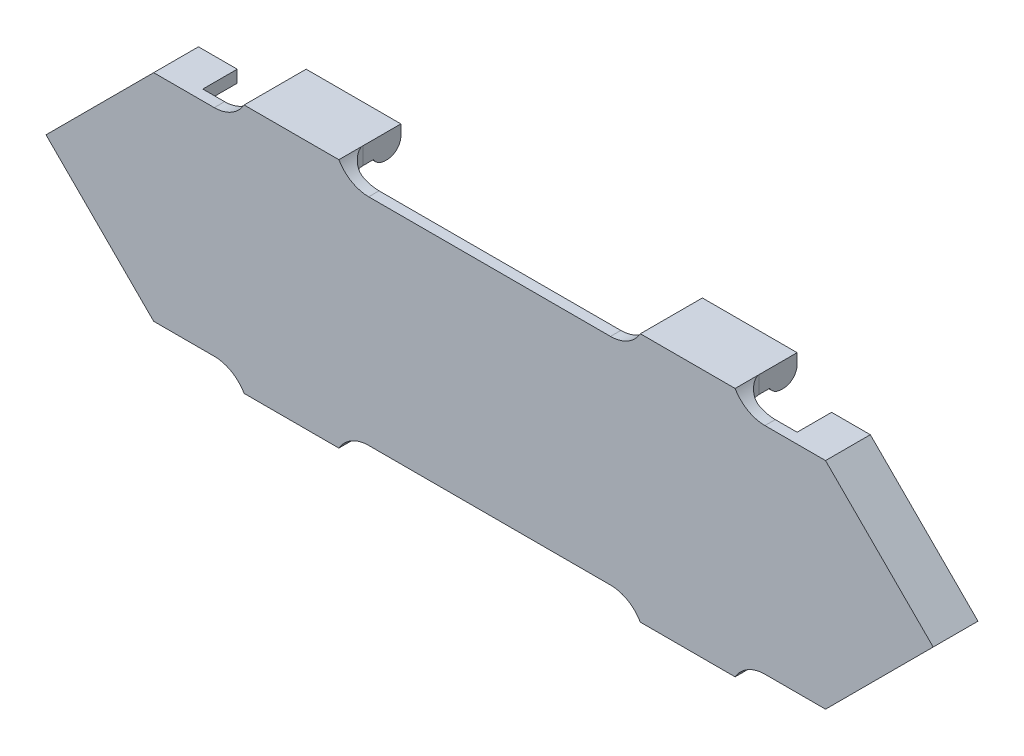
from build123d import *

# Parameters (mm, degrees)
BOSS_EXTRUDE1_DEPTH  = 0.762
BOSS_EXTRUDE2_DEPTH  = 2.54
SKETCH4_W            = 6.985
SKETCH4_H            = 4.572
BOSS_EXTRUDE3_DEPTH  = 1.27
FILLET1_R            = 2.54
SKETCH5_W            = 6.985
SKETCH5_H            = 2.032
BOSS_EXTRUDE4_DEPTH  = 0.508
FILLET2_R            = 1.016
FILLET3_R            = 1.016
FILLET2_OF_MIRROR4_R = 1.016
FILLET4_R            = 2.54
FILLET5_R            = 1.016


with BuildPart() as part:
    # Sketch1 → Boss-Extrude1 (new body)
    with BuildSketch(Plane.XY):
        Polygon((-33.378913043, 6.316869565), (16.151086957, 6.316869565), (24.088586957, -1.620630435), (16.151086957, -9.558130435), (-33.378913043, -9.558130435), (-41.316413043, -1.620630435), align=None)
    extrude(amount=BOSS_EXTRUDE1_DEPTH)

    # Sketch2 → Boss-Extrude2 (add)
    with BuildSketch(Plane(origin=(0, 0, 0), x_dir=(-1, 0, 0), z_dir=(0, 0, -1))):
        Polygon((30.521413043, 6.316869565), (33.378913043, 6.316869565), (41.316413043, -1.620630435), (33.378913043, -9.558130435), (30.521413043, -9.558130435), (30.521413043, -8.660104823), (32.480887431, -8.660104823), (39.520361819, -1.620630435), (32.480887431, 5.418843953), (30.521413043, 5.418843953), align=None)
        Polygon((-16.151086957, -9.558130435), (-24.088586957, -1.620630435), (-16.151086957, 6.316869565), (-13.293586957, 6.316869565), (-13.293586957, 5.418843953), (-15.253061344, 5.418843953), (-22.292535732, -1.620630435), (-15.253061344, -8.660104823), (-13.293586957, -8.660104823), (-13.293586957, -9.558130435), align=None)
    extrude(amount=BOSS_EXTRUDE2_DEPTH)

    # Sketch4 → Boss-Extrude3 (add)
    with BuildSketch(Plane(origin=(0, 6.316869565, 0), x_dir=(1, 0, 0), z_dir=(0, 1, 0))):
        with Locations((5.991086957, 1.524)):
            Rectangle(SKETCH4_W, SKETCH4_H)
        with Locations((-23.218913043, 1.524)):
            Rectangle(SKETCH4_W, SKETCH4_H)
    boss_extrude3 = extrude(amount=BOSS_EXTRUDE3_DEPTH)

    # Fillet1
    # the kernel refuses this fillet: 2.54 mm, written as the material it adds along each edge
    with BuildSketch(Plane(origin=(-26.711413043, 6.316869565, 0.762), x_dir=(-1, 0, 0), z_dir=(0, 0, -1)), Plane(origin=(-19.726413043, 6.316869565, 0), x_dir=(1, 0, 0), z_dir=(0, 0, 1)), Plane(origin=(2.498586957, 6.316869565, 0.762), x_dir=(-1, 0, 0), z_dir=(0, 0, -1)), Plane(origin=(9.483586957, 6.316869565, 0), x_dir=(1, 0, 0), z_dir=(0, 0, 1))) as fillet1_piece_1:
        with BuildLine():
            CenterArc((2.199704526, 2.54), FILLET1_R, 210, 60)
            Line((0, 1.27), (0, 0))
            Line((0, 0), (2.199704526, 0))
        make_face()
    extrude(amount=0.762)

    # Sketch5 → Boss-Extrude4 (add)
    with BuildSketch(Plane.XZ.offset(-6.316869565)):
        with Locations((5.991086957, -2.794)):
            Rectangle(SKETCH5_W, SKETCH5_H)
        with Locations((-23.218913043, -2.794)):
            Rectangle(SKETCH5_W, SKETCH5_H)
    boss_extrude4 = extrude(amount=BOSS_EXTRUDE4_DEPTH)

    # Fillet2
    # the kernel refuses this fillet: 1.016 mm, written as the material it takes off along each edge
    with BuildSketch(Plane(origin=(-0.041413043, 5.808869565, -3.81), x_dir=(0, 1, 0), z_dir=(1, 0, 0))) as fillet2_piece_1:
        with BuildLine():
            CenterArc((FILLET2_R, FILLET2_R), FILLET2_R, 180, 90)
            Line((0, FILLET2_R), (-FILLET2_R * 0.02, FILLET2_R))
            Line((-FILLET2_R * 0.02, FILLET2_R), (-FILLET2_R * 0.02, -FILLET2_R * 0.02))
            Line((-FILLET2_R * 0.02, -FILLET2_R * 0.02), (FILLET2_R, -FILLET2_R * 0.02))
            Line((FILLET2_R, -FILLET2_R * 0.02), (FILLET2_R, 0))
        make_face()
    extrude(amount=12.065, mode=Mode.SUBTRACT)
    with BuildSketch(Plane(origin=(11.683291482, 5.808869565, -1.778), x_dir=(0, 0, -1), z_dir=(-1, 0, 0))) as fillet2_piece_2:
        with BuildLine():
            CenterArc((0.87988181, -1.016), FILLET2_R, 90, 60)
            Line((0, -0.508), (-0.017597636, -0.49784))
            ThreePointArc((-0.017597636, -0.49784), (-0.02032, -0.254), (-0.02032, 0))
            Line((-0.02032, 0), (0, 0.02032))
            Line((0, 0.02032), (0.87988181, 0.02032))
            Line((0.87988181, 0.02032), (0.87988181, 0))
        make_face()
    extrude(amount=11.384409051, mode=Mode.SUBTRACT)
    with BuildSketch(Plane(origin=(-29.251413043, 5.808869565, -3.81), x_dir=(0, 0, 1), z_dir=(1, 0, 0))) as fillet2_piece_3:
        with BuildLine():
            CenterArc((FILLET2_R, -FILLET2_R), FILLET2_R, 90, 90)
            Line((0, -FILLET2_R), (-FILLET2_R * 0.02, -FILLET2_R))
            Line((-FILLET2_R * 0.02, -FILLET2_R), (-FILLET2_R * 0.02, FILLET2_R * 0.02))
            Line((-FILLET2_R * 0.02, FILLET2_R * 0.02), (FILLET2_R, FILLET2_R * 0.02))
            Line((FILLET2_R, FILLET2_R * 0.02), (FILLET2_R, 0))
        make_face()
    extrude(amount=12.065, mode=Mode.SUBTRACT)
    with BuildSketch(Plane(origin=(-17.526708518, 5.808869565, -1.778), x_dir=(0, 1, 0), z_dir=(-1, 0, 0))) as fillet2_piece_4:
        with BuildLine():
            CenterArc((1.016, 0.87988181), FILLET2_R, 180, 60)
            Line((0, 0.87988181), (-0.02032, 0.87988181))
            Line((-0.02032, 0.87988181), (-0.02032, 0))
            Line((-0.02032, 0), (0, -0.02032))
            ThreePointArc((0, -0.02032), (0.254, -0.02032), (0.49784, -0.017597636))
            Line((0.49784, -0.017597636), (0.508, 0))
        make_face()
    extrude(amount=11.384409051, mode=Mode.SUBTRACT)

    # Fillet3
    # the kernel refuses this fillet: 1.016 mm, written as the material it adds along each edge
    with BuildSketch(Plane(origin=(-26.711413043, 10.126869565, 0), x_dir=(-1, 0, 0), z_dir=(0, -1, 0))) as fillet3_piece_1_section:
        with BuildLine():
            CenterArc((FILLET3_R, FILLET3_R), FILLET3_R, 180, 90)
            Line((0, FILLET3_R), (0, 0))
            Line((0, 0), (FILLET3_R, 0))
        make_face()
    fillet3_piece_1 = extrude(amount=3.81, mode=Mode.PRIVATE)
    fillet3_piece_1 = fillet3_piece_1 - Plane(origin=(-28.911117569, 8.856869565, 0), x_dir=(-1, 0, 0), z_dir=(0, 0, 1)) * Cylinder(2.54, 12, mode=Mode.PRIVATE)
    add(fillet3_piece_1)
    with BuildSketch(Plane(origin=(-19.726413043, 10.126869565, 0), x_dir=(1, 0, 0), z_dir=(0, -1, 0))) as fillet3_piece_2_section:
        with BuildLine():
            CenterArc((FILLET3_R, -FILLET3_R), FILLET3_R, 90, 90)
            Line((0, -FILLET3_R), (0, 0))
            Line((0, 0), (FILLET3_R, 0))
        make_face()
    fillet3_piece_2 = extrude(amount=3.81, mode=Mode.PRIVATE)
    fillet3_piece_2 = fillet3_piece_2 - Plane(origin=(-17.526708518, 8.856869565, 0), x_dir=(1, 0, 0), z_dir=(0, 0, -1)) * Cylinder(2.54, 12, mode=Mode.PRIVATE)
    add(fillet3_piece_2)
    with BuildSketch(Plane(origin=(2.498586957, 10.126869565, 0), x_dir=(-1, 0, 0), z_dir=(0, -1, 0))) as fillet3_piece_3_section:
        with BuildLine():
            CenterArc((FILLET3_R, FILLET3_R), FILLET3_R, 180, 90)
            Line((0, FILLET3_R), (0, 0))
            Line((0, 0), (FILLET3_R, 0))
        make_face()
    fillet3_piece_3 = extrude(amount=3.81, mode=Mode.PRIVATE)
    fillet3_piece_3 = fillet3_piece_3 - Plane(origin=(0.298882431, 8.856869565, 0), x_dir=(-1, 0, 0), z_dir=(0, 0, 1)) * Cylinder(2.54, 12, mode=Mode.PRIVATE)
    add(fillet3_piece_3)
    with BuildSketch(Plane(origin=(9.483586957, 10.126869565, 0), x_dir=(1, 0, 0), z_dir=(0, -1, 0))) as fillet3_piece_4_section:
        with BuildLine():
            CenterArc((FILLET3_R, -FILLET3_R), FILLET3_R, 90, 90)
            Line((0, -FILLET3_R), (0, 0))
            Line((0, 0), (FILLET3_R, 0))
        make_face()
    fillet3_piece_4 = extrude(amount=3.81, mode=Mode.PRIVATE)
    fillet3_piece_4 = fillet3_piece_4 - Plane(origin=(11.683291482, 8.856869565, 0), x_dir=(1, 0, 0), z_dir=(0, 0, -1)) * Cylinder(2.54, 12, mode=Mode.PRIVATE)
    add(fillet3_piece_4)

    # Mirror4: Boss-Extrude3, Boss-Extrude4 across plane
    add(boss_extrude3.mirror(Plane.ZX.offset(-1.620630435)))
    add(boss_extrude4.mirror(Plane.ZX.offset(-1.620630435)))

    # Fillet2 of Mirror4
    # the kernel refuses this fillet: 1.016 mm, written as the material it takes off along each edge
    with BuildSketch(Plane(origin=(-0.041413043, -9.050130435, -3.81), x_dir=(0, 0, 1), z_dir=(1, 0, 0)), Plane(origin=(-29.251413043, -9.050130435, -3.81), x_dir=(0, 0, 1), z_dir=(1, 0, 0))) as fillet2_of_mirror4_piece_1:
        with BuildLine():
            CenterArc((FILLET2_OF_MIRROR4_R, FILLET2_OF_MIRROR4_R), FILLET2_OF_MIRROR4_R, 180, 90)
            Line((0, FILLET2_OF_MIRROR4_R), (-FILLET2_OF_MIRROR4_R * 0.02, FILLET2_OF_MIRROR4_R))
            Line((-FILLET2_OF_MIRROR4_R * 0.02, FILLET2_OF_MIRROR4_R), (-FILLET2_OF_MIRROR4_R * 0.02, -FILLET2_OF_MIRROR4_R * 0.02))
            Line((-FILLET2_OF_MIRROR4_R * 0.02, -FILLET2_OF_MIRROR4_R * 0.02), (FILLET2_OF_MIRROR4_R, -FILLET2_OF_MIRROR4_R * 0.02))
            Line((FILLET2_OF_MIRROR4_R, -FILLET2_OF_MIRROR4_R * 0.02), (FILLET2_OF_MIRROR4_R, 0))
        make_face()
    extrude(amount=12.065, mode=Mode.SUBTRACT)
    with BuildSketch(Plane(origin=(11.683291482, -9.050130435, -1.778), x_dir=(0, 0, -1), z_dir=(-1, 0, 0)), Plane(origin=(-17.526708518, -9.050130435, -1.778), x_dir=(0, 0, -1), z_dir=(-1, 0, 0))) as fillet2_of_mirror4_piece_2:
        with BuildLine():
            CenterArc((0.87988181, 1.016), FILLET2_OF_MIRROR4_R, 210, 60)
            Line((0, 0.508), (-0.017597636, 0.49784))
            ThreePointArc((-0.017597636, 0.49784), (-0.02032, 0.254), (-0.02032, 0))
            Line((-0.02032, 0), (0, -0.02032))
            Line((0, -0.02032), (0.87988181, -0.02032))
            Line((0.87988181, -0.02032), (0.87988181, 0))
        make_face()
    extrude(amount=11.384409051, mode=Mode.SUBTRACT)

    # Fillet4
    # the kernel refuses this fillet: 2.54 mm, written as the material it adds along each edge
    with BuildSketch(Plane(origin=(-26.711413043, -9.558130435, 0.762), x_dir=(-1, 0, 0), z_dir=(0, 0, -1)), Plane(origin=(-19.726413043, -9.558130435, 0), x_dir=(1, 0, 0), z_dir=(0, 0, 1)), Plane(origin=(2.498586957, -9.558130435, 0.762), x_dir=(-1, 0, 0), z_dir=(0, 0, -1)), Plane(origin=(9.483586957, -9.558130435, 0), x_dir=(1, 0, 0), z_dir=(0, 0, 1))) as fillet4_piece_1:
        with BuildLine():
            CenterArc((2.199704526, -2.54), FILLET4_R, 90, 60)
            Line((0, -1.27), (0, 0))
            Line((0, 0), (2.199704526, 0))
        make_face()
    extrude(amount=0.762)

    # Fillet5
    # the kernel refuses this fillet: 1.016 mm, written as the material it adds along each edge
    with BuildSketch(Plane(origin=(-26.711413043, -13.368130435, 0), x_dir=(-1, 0, 0), z_dir=(0, 1, 0))) as fillet5_piece_1_section:
        with BuildLine():
            CenterArc((FILLET5_R, -FILLET5_R), FILLET5_R, 90, 90)
            Line((0, -FILLET5_R), (0, 0))
            Line((0, 0), (FILLET5_R, 0))
        make_face()
    fillet5_piece_1 = extrude(amount=3.81, mode=Mode.PRIVATE)
    fillet5_piece_1 = fillet5_piece_1 - Plane(origin=(-28.911117569, -12.098130435, 0), x_dir=(-1, 0, 0), z_dir=(0, 0, 1)) * Cylinder(2.54, 12, mode=Mode.PRIVATE)
    add(fillet5_piece_1)
    with BuildSketch(Plane(origin=(9.483586957, -13.368130435, 0), x_dir=(1, 0, 0), z_dir=(0, 1, 0))) as fillet5_piece_2_section:
        with BuildLine():
            CenterArc((FILLET5_R, FILLET5_R), FILLET5_R, 180, 90)
            Line((0, FILLET5_R), (0, 0))
            Line((0, 0), (FILLET5_R, 0))
        make_face()
    fillet5_piece_2 = extrude(amount=3.81, mode=Mode.PRIVATE)
    fillet5_piece_2 = fillet5_piece_2 - Plane(origin=(11.683291482, -12.098130435, 0), x_dir=(1, 0, 0), z_dir=(0, 0, -1)) * Cylinder(2.54, 12, mode=Mode.PRIVATE)
    add(fillet5_piece_2)
    with BuildSketch(Plane(origin=(-19.726413043, -13.368130435, 0), x_dir=(1, 0, 0), z_dir=(0, 1, 0))) as fillet5_piece_3_section:
        with BuildLine():
            CenterArc((FILLET5_R, FILLET5_R), FILLET5_R, 180, 90)
            Line((0, FILLET5_R), (0, 0))
            Line((0, 0), (FILLET5_R, 0))
        make_face()
    fillet5_piece_3 = extrude(amount=3.81, mode=Mode.PRIVATE)
    fillet5_piece_3 = fillet5_piece_3 - Plane(origin=(-17.526708518, -12.098130435, 0), x_dir=(1, 0, 0), z_dir=(0, 0, -1)) * Cylinder(2.54, 12, mode=Mode.PRIVATE)
    add(fillet5_piece_3)
    with BuildSketch(Plane(origin=(2.498586957, -13.368130435, 0), x_dir=(-1, 0, 0), z_dir=(0, 1, 0))) as fillet5_piece_4_section:
        with BuildLine():
            CenterArc((FILLET5_R, -FILLET5_R), FILLET5_R, 90, 90)
            Line((0, -FILLET5_R), (0, 0))
            Line((0, 0), (FILLET5_R, 0))
        make_face()
    fillet5_piece_4 = extrude(amount=3.81, mode=Mode.PRIVATE)
    fillet5_piece_4 = fillet5_piece_4 - Plane(origin=(0.298882431, -12.098130435, 0), x_dir=(-1, 0, 0), z_dir=(0, 0, 1)) * Cylinder(2.54, 12, mode=Mode.PRIVATE)
    add(fillet5_piece_4)


solid = part.part
